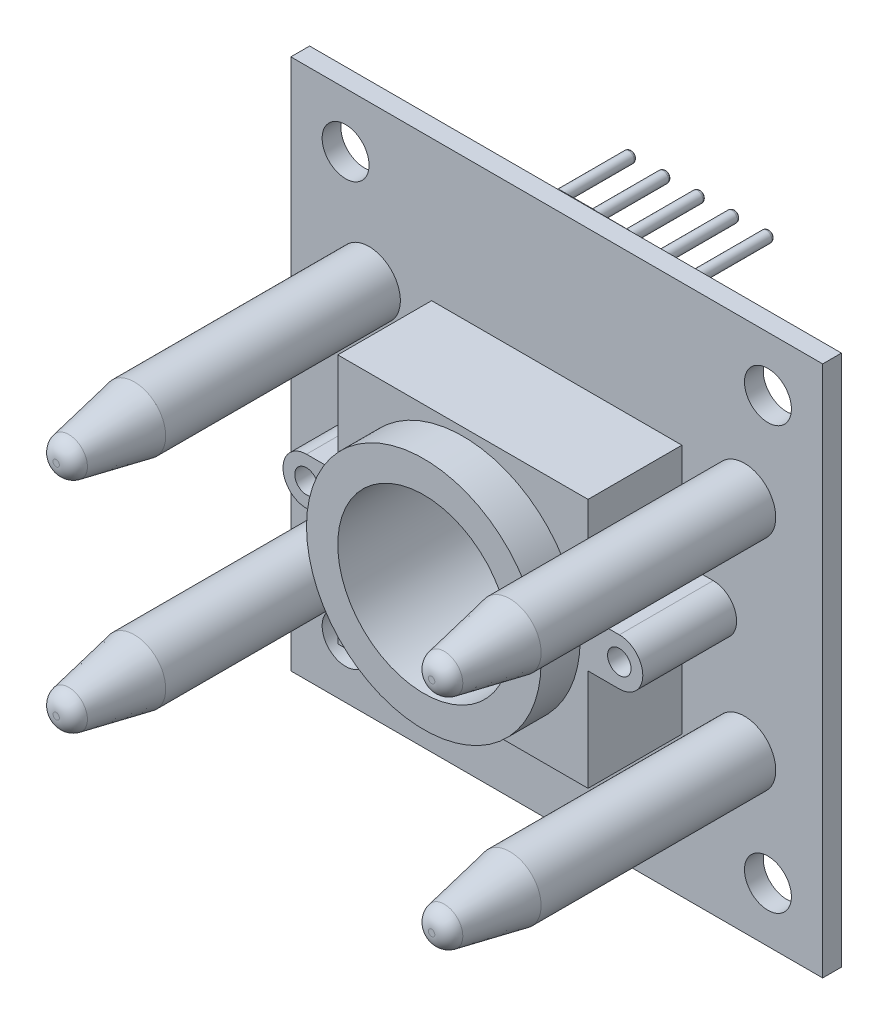
from build123d import *

# Parameters (mm, degrees)
SKETCH1_W            = 34
SKETCH1_H            = 34
BOSS_EXTRUDE1_DEPTH  = 1.2
SKETCH2_W            = 16
SKETCH2_H            = 16
BOSS_EXTRUDE2_DEPTH  = 6
SKETCH3_R            = 5.5
CUT_EXTRUDE1_DEPTH   = 6
SKETCH4_R            = 1.5
BOSS_EXTRUDE3_DEPTH  = 6
SKETCH6_R            = 0.75
CUT_EXTRUDE2_DEPTH   = 6
BOSS_EXTRUDE4_START  = 2.5
SKETCH8_R            = 7.5
SKETCH8_R_2          = 5.5
BOSS_EXTRUDE4_DEPTH  = 2.5
SKETCH9_R            = 2
BOSS_EXTRUDE5_DEPTH  = 15
SKETCH12_R           = 2
BOSS_EXTRUDE6_DEPTH  = 5
BOSS_EXTRUDE6_TAPER  = 11
FILLET6_R            = 1
FILLET6_OF_MIRROR1_R = 1
SKETCH14_R           = 1.5
CUT_EXTRUDE3_DEPTH   = 5
SKETCH15_W           = 2.2
SKETCH15_H           = 2.5
SKETCH15_W_2         = 2.192844648
SKETCH15_H_2         = 2.491868918
SKETCH15_W_3         = 2.22607144
SKETCH15_H_3         = 2.529626636
SKETCH15_W_4         = 2.298461583
SKETCH15_H_4         = 2.611888162
BOSS_EXTRUDE7_DEPTH  = 2
FILLET7_R            = 0.1
SKETCH16_R           = 0.35
BOSS_EXTRUDE8_DEPTH  = 5.5
FILLET8_R            = 0.2
FILLET9_R            = 0.2
FILLET10_R           = 0.2


# Read off the part's stored shape, not the designer's step: Mirror2
with BuildPart() as part:
    # Sketch1 → Boss-Extrude1 (new body)
    with BuildSketch(Plane.XY):
        Rectangle(SKETCH1_W, SKETCH1_H)
    extrude(amount=BOSS_EXTRUDE1_DEPTH)

    # Sketch2 → Boss-Extrude2 (add)
    with BuildSketch(Plane.XY.offset(1.2)):
        Rectangle(SKETCH2_W, SKETCH2_H)
    extrude(amount=BOSS_EXTRUDE2_DEPTH)

    # Sketch3 → Cut-Extrude1 (cut)
    with BuildSketch(Plane.XY.offset(7.2)):
        Circle(SKETCH3_R)
    extrude(amount=-CUT_EXTRUDE1_DEPTH, mode=Mode.SUBTRACT)

    # Sketch4 → Boss-Extrude3 (add)
    with BuildSketch(Plane.XY.offset(1.2)):
        with BuildLine():
            ThreePointArc((10, -1.5), (8.5, 0), (10, 1.5))
            Line((10, 1.5), (8, 1.5))
            Line((8, 1.5), (8, -1.5))
            Line((8, -1.5), (10, -1.5))
        make_face()
        with Locations((10, 0)):
            Circle(SKETCH4_R)
        with Locations((-10, 0)):
            Circle(SKETCH4_R)
        with BuildLine():
            ThreePointArc((-8.5, 0), (-8.939339828, -1.060660172), (-10, -1.5))
            Line((-10, -1.5), (-8, -1.5))
            Line((-8, -1.5), (-8, 1.5))
            Line((-8, 1.5), (-10, 1.5))
            ThreePointArc((-10, 1.5), (-8.939339828, 1.060660172), (-8.5, 0))
        make_face()
    extrude(amount=BOSS_EXTRUDE3_DEPTH)

    # Sketch6 → Cut-Extrude2 (cut)
    with BuildSketch(Plane.XY.offset(7.2)):
        with Locations((10, 0)):
            Circle(SKETCH6_R)
        with Locations(Location((-10, 0, 0), (0, 0, 180))):
            Circle(SKETCH6_R)
    extrude(amount=-CUT_EXTRUDE2_DEPTH, mode=Mode.SUBTRACT)

    # Sketch8 → Boss-Extrude4 (add)
    with BuildSketch(Plane.XY.offset(7.2).offset(BOSS_EXTRUDE4_START)):
        Circle(SKETCH8_R)
        Circle(SKETCH8_R_2, mode=Mode.SUBTRACT)
    extrude(amount=-BOSS_EXTRUDE4_DEPTH)

    # Sketch9 → Boss-Extrude5 (add)
    with BuildSketch(Plane.XY.offset(1.2)):
        with Locations((-12, -7)):
            Circle(SKETCH9_R)
        with Locations(Location((12, -7, 0), (0, 0, 180))):
            Circle(SKETCH9_R)
        with Locations((12, 7)):
            Circle(SKETCH9_R)
        with Locations(Location((-12, 7, 0), (0, 0, 180))):
            Circle(SKETCH9_R)
    extrude(amount=BOSS_EXTRUDE5_DEPTH)

    # Sketch12 → Boss-Extrude6 (add)
    with BuildSketch(Plane.XY.offset(16.2)):
        with Locations(Location((-12, 7, 0), (0, 0, 180))):
            Circle(SKETCH12_R)
    boss_extrude6 = extrude(amount=BOSS_EXTRUDE6_DEPTH, taper=BOSS_EXTRUDE6_TAPER)

    # Fillet6
    fillet6_edges = [part.edges().sort_by_distance(p)[0] for p in [
        (-10.971901546, 7, 21.2),
    ]]
    fillet(fillet6_edges, radius=FILLET6_R)

    # Mirror1: Boss-Extrude6 across plane
    add(boss_extrude6.mirror(Plane(origin=(0, 0, 0), x_dir=(0, 0, 1), z_dir=(1, 0, 0))))

    # Fillet6 of Mirror1
    fillet6_of_mirror1_edges = [part.edges().sort_by_distance(p)[0] for p in [
        (10.971901546, 7, 21.2),
    ]]
    fillet(fillet6_of_mirror1_edges, radius=FILLET6_OF_MIRROR1_R)

    # Mirror2 outline → Mirror2 (revolve)
    with BuildSketch(Plane(origin=(-12, -7, 0), x_dir=(1, 0, 0), z_dir=(0, -1, 0))):
        with BuildLine():
            Line((0.203762068, 21.2), (0, 21.2))
            Line((0, 21.2), (0, 16.2))
            Line((0, 16.2), (2, 16.2))
            Line((2, 16.2), (1.185389252, 20.390808995))
            ThreePointArc((1.185389252, 20.390808995), (0.839840289, 20.971624583), (0.203762068, 21.2))
        make_face()
    revolve(axis=Axis((-12, -7, 0), (0, 0, 1)))

    # Mirror2 2 outline → Mirror2 2 (revolve)
    with BuildSketch(Plane(origin=(12, -7, 0), x_dir=(1, 0, 0), z_dir=(0, -1, 0))):
        with BuildLine():
            Line((0.203762068, 21.2), (0, 21.2))
            Line((0, 21.2), (0, 16.2))
            Line((0, 16.2), (2, 16.2))
            Line((2, 16.2), (1.185389252, 20.390808995))
            ThreePointArc((1.185389252, 20.390808995), (0.839840289, 20.971624583), (0.203762068, 21.2))
        make_face()
    revolve(axis=Axis((12, -7, 0), (0, 0, 1)))

    # Sketch14 → Cut-Extrude3 (cut)
    with BuildSketch(Plane.XY.offset(1.2)):
        with Locations((-13.5, -13.5)):
            Circle(SKETCH14_R)
        with Locations((13.5, -13.5)):
            Circle(SKETCH14_R)
        with Locations((13.5, 13.5)):
            Circle(SKETCH14_R)
        with Locations((-13.5, 13.5)):
            Circle(SKETCH14_R)
    extrude(amount=-CUT_EXTRUDE3_DEPTH, mode=Mode.SUBTRACT)

    # Sketch15 → Boss-Extrude7 (add)
    with BuildSketch(Plane(origin=(0, 0, 0), x_dir=(-1, 0, 0), z_dir=(0, 0, -1))):
        with Locations((-4.9, -13.75)):
            Rectangle(SKETCH15_W, SKETCH15_H)
        with Locations((-2.664822821, -13.75)):
            Rectangle(SKETCH15_W_2, SKETCH15_H_2)
        with Locations((-0.415924927, -13.75)):
            Rectangle(SKETCH15_W_3, SKETCH15_H_3)
        with Locations((1.883396687, -13.729844671)):
            Rectangle(SKETCH15_W_4, SKETCH15_H_4)
        with Locations((4.142150046, -13.740303192)):
            Rectangle(SKETCH15_W, SKETCH15_H)
        with Locations((4.142150046, 13.740303192)):
            Rectangle(SKETCH15_W, SKETCH15_H)
        with Locations((1.883396687, 13.729844671)):
            Rectangle(SKETCH15_W_4, SKETCH15_H_4)
        with Locations((-0.415924927, 13.75)):
            Rectangle(SKETCH15_W_3, SKETCH15_H_3)
        with Locations((-2.664822821, 13.75)):
            Rectangle(SKETCH15_W_2, SKETCH15_H_2)
        with Locations((-4.9, 13.75)):
            Rectangle(SKETCH15_W, SKETCH15_H)
    extrude(amount=BOSS_EXTRUDE7_DEPTH)

    # Fillet7
    fillet7_edges = [part.edges().sort_by_distance(p)[0] for p in [
        (3.8, -15, -1),
        (3.8, -12.5, -1),
        (6, -12.5, -1),
        (6, -15, -1),
    ]]
    fillet(fillet7_edges, radius=FILLET7_R)

    # Sketch16 → Boss-Extrude8 (add)
    with BuildSketch(Plane(origin=(0, 0, -2), x_dir=(-1, 0, 0), z_dir=(0, 0, -1))):
        with Locations(Location((-4.9, -13.75, 0), (0, 0, 180))):
            Circle(SKETCH16_R)
        with Locations(Location((-2.7, -13.75, 0), (0, 0, 180))):
            Circle(SKETCH16_R)
        with Locations(Location((-0.5, -13.75, 0), (0, 0, 180))):
            Circle(SKETCH16_R)
        with Locations(Location((1.7, -13.75, 0), (0, 0, 180))):
            Circle(SKETCH16_R)
        with Locations(Location((3.9, -13.75, 0), (0, 0, 180))):
            Circle(SKETCH16_R)
        with Locations(Location((3.9, 13.75, 0), (0, 0, 180))):
            Circle(SKETCH16_R)
        with Locations(Location((1.7, 13.75, 0), (0, 0, 180))):
            Circle(SKETCH16_R)
        with Locations(Location((-0.5, 13.75, 0), (0, 0, 180))):
            Circle(SKETCH16_R)
        with Locations(Location((-2.7, 13.75, 0), (0, 0, 180))):
            Circle(SKETCH16_R)
        with Locations(Location((-4.9, 13.75, 0), (0, 0, 180))):
            Circle(SKETCH16_R)
    extrude(amount=BOSS_EXTRUDE8_DEPTH)

    # Fillet8
    fillet8_edges = [part.edges().sort_by_distance(p)[0] for p in [
        (4.55, -13.75, -7.5),
    ]]
    fillet(fillet8_edges, radius=FILLET8_R)

    # Fillet9
    fillet9_edges = [part.edges().sort_by_distance(p)[0] for p in [
        (2.35, -13.75, -7.5),
        (0.15, -13.75, -7.5),
        (-2.05, -13.75, -7.5),
        (-4.25, -13.75, -7.5),
    ]]
    fillet(fillet9_edges, radius=FILLET9_R)

    # Fillet10
    fillet10_edges = [part.edges().sort_by_distance(p)[0] for p in [
        (-4.25, 13.75, -7.5),
        (-2.05, 13.75, -7.5),
        (0.15, 13.75, -7.5),
        (2.35, 13.75, -7.5),
        (4.55, 13.75, -7.5),
    ]]
    fillet(fillet10_edges, radius=FILLET10_R)


solid = part.part
